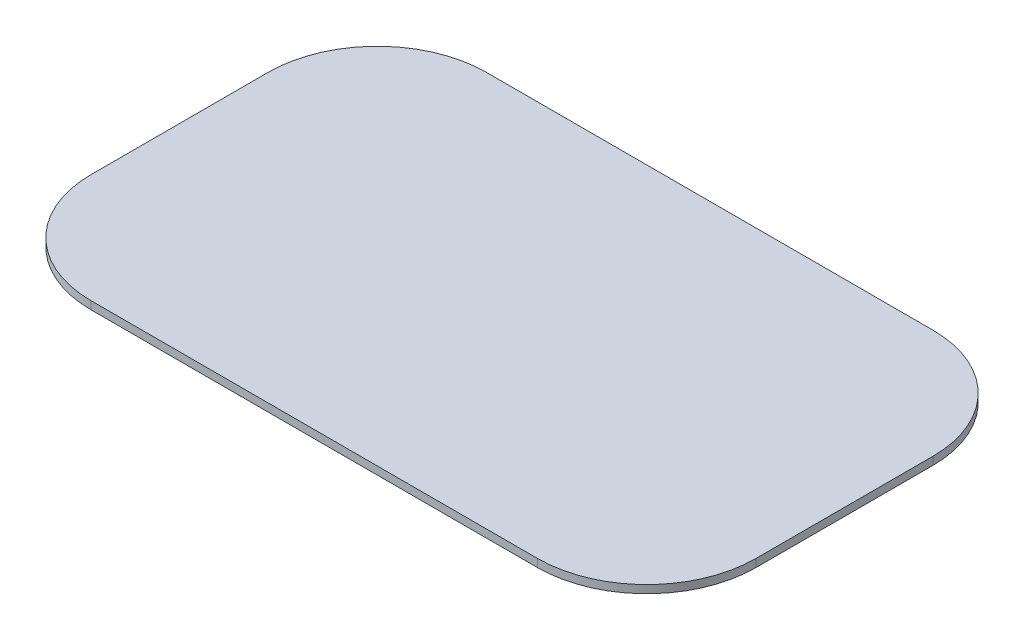
from build123d import *

# Parameters (mm, degrees)
BOSS_EXTRUDE1_DEPTH = 4


with BuildPart() as part:
    # Sketch1 → Boss-Extrude1 (new body)
    with BuildSketch(Plane(origin=(0, 0, 0), x_dir=(1, 0, 0), z_dir=(0, 1, 0))):
        with BuildLine():
            Line((-9.966577693, 27.987014401), (215.063422307, 27.987014401))
            ThreePointArc((215.063422307, 27.987014401), (253.954295273, 11.877887367), (270.063422307, -27.012985599))
            Line((270.063422307, -27.012985599), (270.063422307, -116.272985599))
            ThreePointArc((270.063422307, -116.272985599), (253.954295273, -155.163858564), (215.063422307, -171.272985599))
            Line((215.063422307, -171.272985599), (-9.966577693, -171.272985599))
            ThreePointArc((-9.966577693, -171.272985599), (-48.857450658, -155.163858564), (-64.966577693, -116.272985599))
            Line((-64.966577693, -116.272985599), (-64.966577693, -27.012985599))
            ThreePointArc((-64.966577693, -27.012985599), (-48.857450658, 11.877887367), (-9.966577693, 27.987014401))
        make_face()
    extrude(amount=BOSS_EXTRUDE1_DEPTH)


solid = part.part
